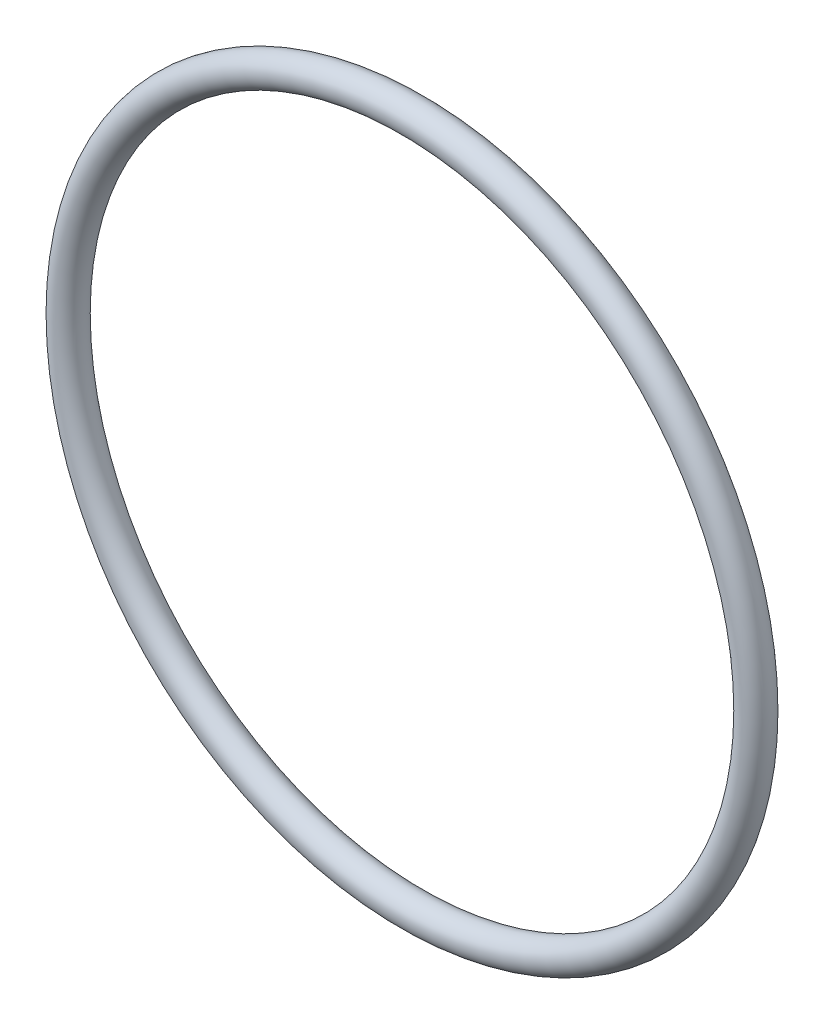
from build123d import *

# Parameters (mm, degrees)
ESBO_O2_R = 1.5


with BuildPart() as part:
    # Esboço2 → Revolução1 (revolve)
    with BuildSketch(Plane(origin=(0, 0, 0), x_dir=(0, 0, -1), z_dir=(1, 0, 0))):
        with Locations((0, 0.5)):
            Circle(ESBO_O2_R)
    revolve(axis=Axis((0, -32.5, -88.99), (0, 0, 1)))


solid = part.part
